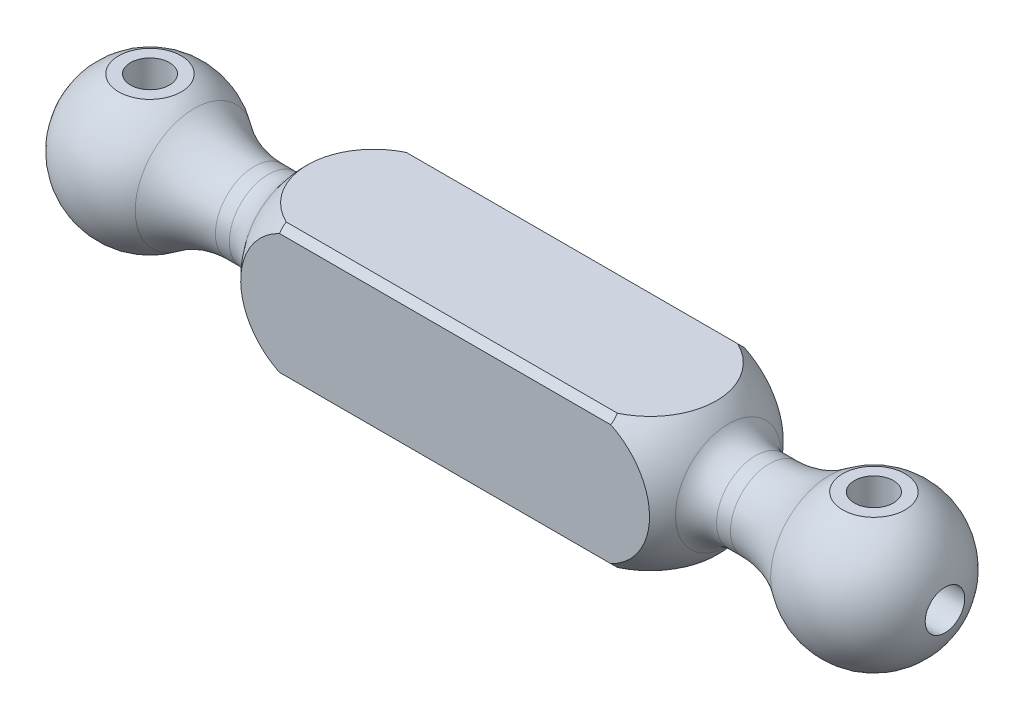
from build123d import *
from build123d.topology import SkipClean

# Parameters (mm, degrees)
CUT_EXTRUDE1_DEPTH       = 41.231167955
CUT_EXTRUDE1_DEPTH_BACK  = 41.231167955
BOSS_EXTRUDE1_DEPTH      = 6
BOSS_EXTRUDE1_DEPTH_BACK = 6
SKETCH2_W                = 43.75
SKETCH2_H                = 12
FILLET1_R                = 9
SKETCH4_R                = 1.75
CUT_EXTRUDE2_DEPTH       = 42.456679229
CUT_EXTRUDE3_DEPTH       = 41.132982089
CUT_EXTRUDE3_DEPTH_BACK  = 41.132982089
SKETCH7_R                = 1.775
CHAMFER1_SIZE            = 0.6


# Read off the part's stored shape, not the designer's step: Cut-Revolve1
with BuildPart() as part:
    # Sketch1 → Revolve2 (revolve)
    with BuildSketch(Plane.XY, mode=Mode.PRIVATE) as revolve2_sk:
        with BuildLine():
            Line((-29.690974368, 6), (-35.309025632, 6))
            ThreePointArc((-35.309025632, 6), (-38.090188718, 3.555336144), (-39.125, 0))
            Line((-39.125, 0), (-29.875, 0))
            Line((-29.875, 0), (-29.875, 3.5))
            Line((-29.875, 3.5), (-26.875, 3.5))
            ThreePointArc((-26.875, 3.5), (-28.101625631, 4.954283794), (-29.690974368, 6))
        make_face()
        with BuildLine():
            ThreePointArc((-29.690974368, 6), (-32.5, 6.625), (-35.309025632, 6))
            Line((-35.309025632, 6), (-29.690974368, 6))
        make_face()
        with BuildLine():
            ThreePointArc((-25.875, 0), (-26.129903847, 1.820027472), (-26.875, 3.5))
            Line((-26.875, 3.5), (-29.875, 3.5))
            Line((-29.875, 3.5), (-29.875, 0))
            Line((-29.875, 0), (-25.875, 0))
        make_face()
        with BuildLine():
            Line((-21.875, 3.5), (-26.875, 3.5))
            ThreePointArc((-26.875, 3.5), (-26.129903847, 1.820027472), (-25.875, 0))
            Line((-25.875, 0), (-21.875, 0))
            Line((-21.875, 0), (-21.875, 3.5))
        make_face()
        with BuildLine():
            ThreePointArc((25.875, 0), (26.129903847, 1.820027472), (26.875, 3.5))
            Line((26.875, 3.5), (21.875, 3.5))
            Line((21.875, 3.5), (21.875, 0))
            Line((21.875, 0), (25.875, 0))
        make_face()
        with BuildLine():
            Line((29.875, 3.5), (26.875, 3.5))
            ThreePointArc((26.875, 3.5), (26.129903847, 1.820027472), (25.875, 0))
            Line((25.875, 0), (29.875, 0))
            Line((29.875, 0), (29.875, 3.5))
        make_face()
        with BuildLine():
            ThreePointArc((35.309025632, 6), (32.5, 6.625), (29.690974368, 6))
            Line((29.690974368, 6), (35.309025632, 6))
        make_face()
        with BuildLine():
            Line((35.309025632, 6), (29.690974368, 6))
            ThreePointArc((29.690974368, 6), (28.101625631, 4.954283794), (26.875, 3.5))
            Line((26.875, 3.5), (29.875, 3.5))
            Line((29.875, 3.5), (29.875, 0))
            Line((29.875, 0), (39.125, 0))
            ThreePointArc((39.125, 0), (38.090188718, 3.555336144), (35.309025632, 6))
        make_face()
    revolve(revolve2_sk.sketch.rotate(Axis((-51.032725147, 0, 0), (1, 0, 0)), 90), axis=Axis((-51.032725147, 0, 0), (1, 0, 0)))

    # Sketch1<4> → Cut-Extrude1 (cut, two sides: drawn at the far end of the back side and taken through both)
    with SkipClean():  # the faces are left unmerged after this step: merging them gives an invalid solid
        with BuildSketch(Plane.XY.offset(-CUT_EXTRUDE1_DEPTH_BACK)):
            with BuildLine():
                Line((-29.690974368, -6), (-35.309025632, -6))
                ThreePointArc((-35.309025632, -6), (-32.5, -6.625), (-29.690974368, -6))
            make_face()
            with BuildLine():
                ThreePointArc((-29.690974368, 6), (-32.5, 6.625), (-35.309025632, 6))
                Line((-35.309025632, 6), (-29.690974368, 6))
            make_face()
            with BuildLine():
                Line((35.309025632, -6), (29.690974368, -6))
                ThreePointArc((29.690974368, -6), (32.5, -6.625), (35.309025632, -6))
            make_face()
            with BuildLine():
                ThreePointArc((35.309025632, 6), (32.5, 6.625), (29.690974368, 6))
                Line((29.690974368, 6), (35.309025632, 6))
            make_face()
        extrude(amount=CUT_EXTRUDE1_DEPTH + CUT_EXTRUDE1_DEPTH_BACK, mode=Mode.SUBTRACT)

    # Sketch2 → Boss-Extrude1 (add, two sides: drawn at the far end of the back side and taken through both)
    with SkipClean():  # the faces are left unmerged after this step: merging them gives an invalid solid
        with BuildSketch(Plane.XY.offset(-BOSS_EXTRUDE1_DEPTH_BACK)):
            Rectangle(SKETCH2_W, SKETCH2_H)
        extrude(amount=BOSS_EXTRUDE1_DEPTH + BOSS_EXTRUDE1_DEPTH_BACK)

    # Fillet1
    fillet1_edges = [part.edges().sort_by_distance(p)[0] for p in [
        (-26.875, 0, -3.5),
        (26.875, 0, -3.5),
    ]]
    fillet(fillet1_edges, radius=FILLET1_R)

    # Cut-Revolve1 outline → Cut-Revolve1 (revolve, cut)
    with SkipClean():  # the faces are left unmerged after this step: merging them gives an invalid solid
        with BuildSketch(Plane.YX):
            with BuildLine():
                ThreePointArc((4.75, -19.438301414), (3.830730437, -20.505693606), (3.5, -21.875))
                Line((3.5, -21.875), (8.485281374, -21.875))
                Line((8.485281374, -21.875), (8.485281382, -12.642713662))
                ThreePointArc((8.485281382, -12.642713662), (7.387066136, -16.463432036), (4.75, -19.438301414))
            make_face()
            with BuildLine():
                ThreePointArc((4.75, 19.438301414), (7.387066136, 16.463432036), (8.485281382, 12.642713662))
                Line((8.485281382, 12.642713662), (8.485281382, 21.875))
                Line((8.485281382, 21.875), (3.5, 21.875))
                ThreePointArc((3.5, 21.875), (3.830730437, 20.505693606), (4.75, 19.438301414))
            make_face()
        revolve(axis=Axis((0, 0, 0), (1, 0, 0)), mode=Mode.SUBTRACT)

    # Sketch4 → Cut-Extrude2 (cut, through all)
    with SkipClean():  # the faces are left unmerged after this step: merging them gives an invalid solid
        with BuildSketch(Plane.XZ.offset(6)):
            with Locations(Location((-32.5, 0, 0), (0, 0, 270))):
                Circle(SKETCH4_R)
            with Locations(Location((32.5, 0, 0), (0, 0, 270))):
                Circle(SKETCH4_R)
        extrude(amount=-CUT_EXTRUDE2_DEPTH, mode=Mode.SUBTRACT)

    # Sketch7 → Cut-Extrude3 (cut, two sides: drawn at the far end of the back side and taken through both)
    with SkipClean():  # the faces are left unmerged after this step: merging them gives an invalid solid
        with BuildSketch(Plane(origin=(0, 0, 0), x_dir=(0, 0, -1), z_dir=(1, 0, 0)).offset(-CUT_EXTRUDE3_DEPTH_BACK)):
            Circle(SKETCH7_R)
        extrude(amount=CUT_EXTRUDE3_DEPTH + CUT_EXTRUDE3_DEPTH_BACK, mode=Mode.SUBTRACT)

    # Chamfer1
    chamfer1_edges = [part.edges().sort_by_distance(p)[0] for p in [
        (0, -6, 6),
        (0, -6, -6),
        (0, 6, -6),
        (0, 6, 6),
    ]]
    chamfer(chamfer1_edges, length=CHAMFER1_SIZE)


solid = part.part
